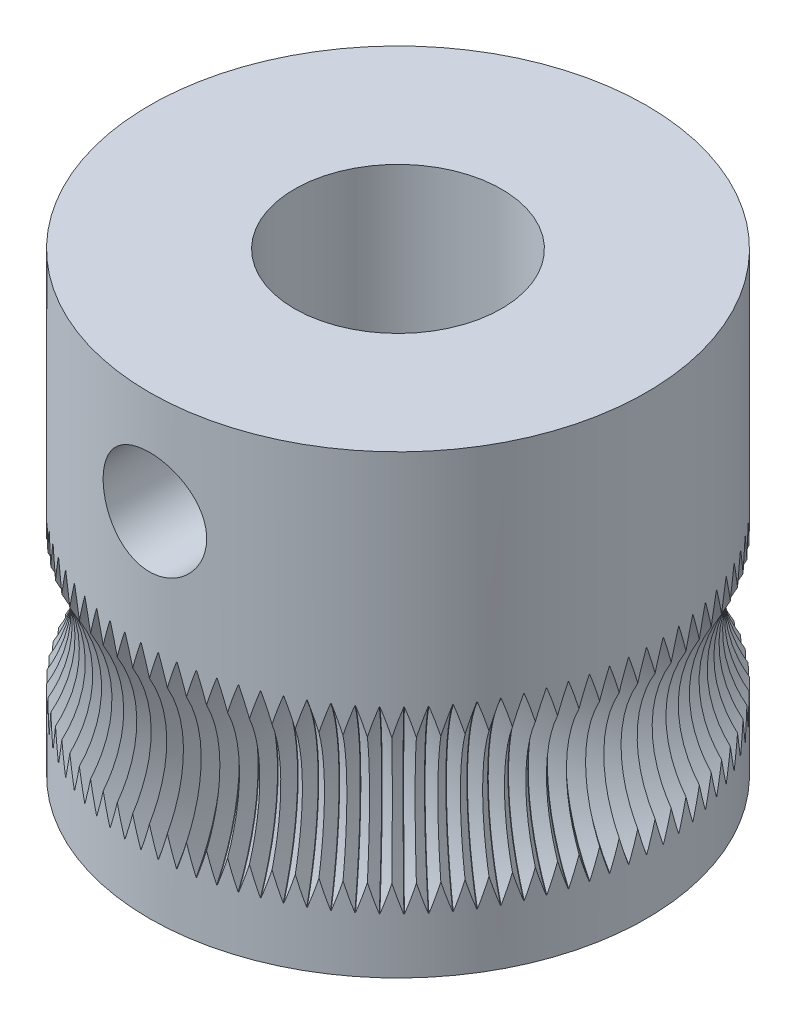
from build123d import *

# Parameters (mm, degrees)
SKETCH1_R              = 6
SKETCH1_R_2            = 2.5
BOSS_EXTRUDE1_DEPTH    = 11
M3_TAPPED_HOLE1_REACH  = 19.349
M3_TAPPED_HOLE1_BORE_R = 1.25
CIRPATTERN1_COUNT      = 90


with BuildPart() as part:
    # Sketch1 → Boss-Extrude1 (new body)
    with BuildSketch(Plane(origin=(0, 0, 0), x_dir=(1, 0, 0), z_dir=(0, 1, 0))):
        with Locations(Location((0, 0, 0), (0, 0, 270))):
            Circle(SKETCH1_R)
        with Locations(Location((0, 0, 0), (0, 0, 270))):
            Circle(SKETCH1_R_2, mode=Mode.SUBTRACT)
    extrude(amount=BOSS_EXTRUDE1_DEPTH)

    # M3 Tapped Hole1 bore → M3 Tapped Hole1 (cut, up to next)
    with BuildSketch(Plane.XY.offset(6), mode=Mode.PRIVATE) as m3_tapped_hole1_sk1:
        with Locations((0, 8.5)):
            Circle(M3_TAPPED_HOLE1_BORE_R)
    m3_tapped_hole1_tool1 = extrude(m3_tapped_hole1_sk1.sketch, amount=-M3_TAPPED_HOLE1_REACH, mode=Mode.PRIVATE) & part.part
    add(m3_tapped_hole1_tool1.solids().sort_by_distance((0, 8.5, 6))[0], mode=Mode.SUBTRACT)

    # Cut-Sweep1: sweep along a path in Sketch8
    with BuildLine(Plane.XY) as cut_sweep1_path:
        CenterArc((8.75, 3.5), 3.5, 0, 360)
    # Sketch10 → Cut-Sweep1 (sweep, cut)
    with BuildSketch(Plane(origin=(8.75, 0, 0), x_dir=(0, 0, -1), z_dir=(1, 0, 0))):
        Polygon((-0.969651225, 5.329175067), (0.969651225, 5.329175067), (0.005, 7), (-0.005, 7), align=None)
    cut_sweep1 = sweep(path=cut_sweep1_path.line, mode=Mode.SUBTRACT)

    # CirPattern1: Cut-Sweep1 ×90 about axis
    cirpattern1_axis = Axis((0, 11, 0), (0, -1, 0))
    for i in range(1, CIRPATTERN1_COUNT):
        add(cut_sweep1.rotate(cirpattern1_axis, i * 360 / CIRPATTERN1_COUNT), mode=Mode.SUBTRACT)


solid = part.part
